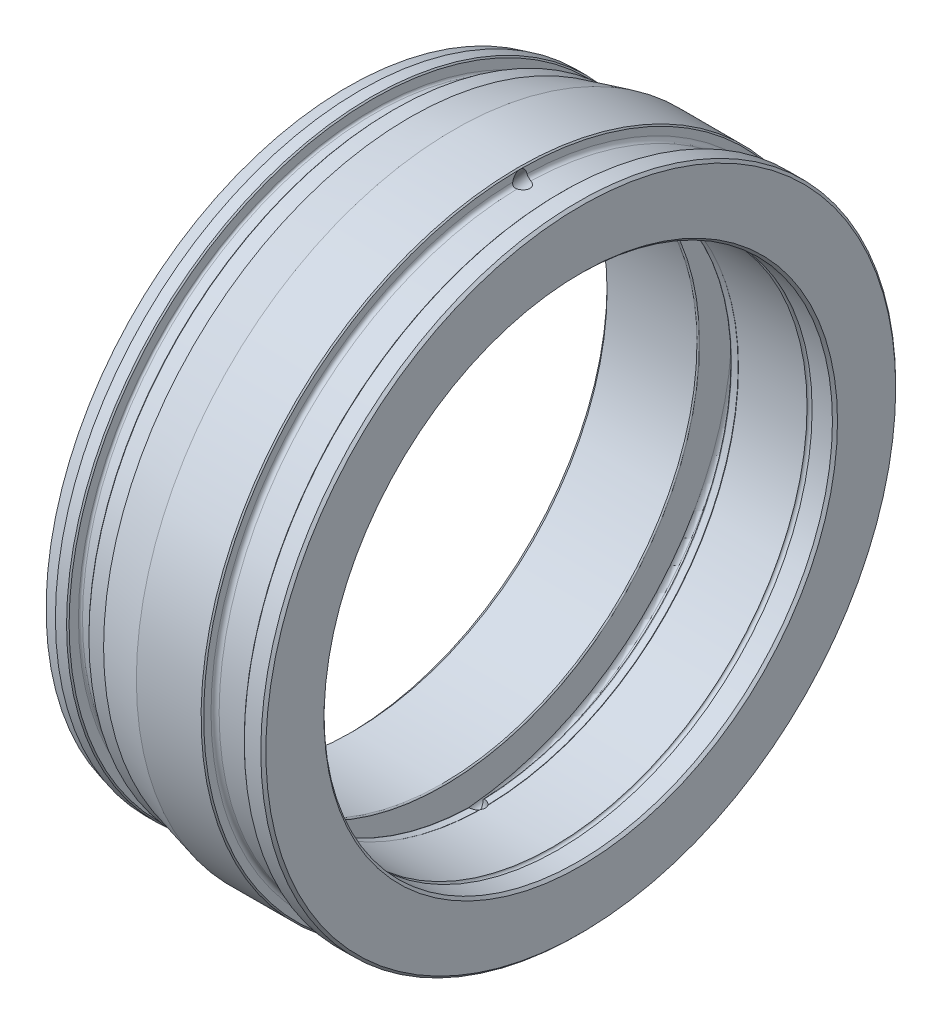
from build123d import *

# Parameters (mm, degrees)
SKETCH2_R          = 1.5
CUT_EXTRUDE1_DEPTH = 142.654606394
CIRPATTERN1_COUNT  = 2
FILLET1_R          = 0.25
CUT_EXTRUDE2_DEPTH = 0.01


with BuildPart() as part:
    # Sketch1 → Revolve1 (revolve)
    with BuildSketch(Plane.XY):
        with BuildLine():
            Line((0, 50.545), (0, 62.0025))
            Line((0, 62.0025), (-0.5, 62.5025))
            Line((-0.5, 62.5025), (-3.75, 62.5025))
            Line((-3.75, 62.5025), (-4, 62.2525))
            Line((-4, 62.2525), (-4, 60.8))
            ThreePointArc((-4, 60.8), (-4.234314575, 60.234314575), (-4.8, 60))
            Line((-4.8, 60), (-11.2, 60))
            ThreePointArc((-11.2, 60), (-11.765685425, 60.234314575), (-12, 60.8))
            Line((-12, 60.8), (-12, 62.2525))
            Line((-12, 62.2525), (-12.25, 62.5025))
            Line((-12.25, 62.5025), (-25, 62.5025))
            Line((-25, 62.5025), (-33.7, 60.25))
            Line((-33.7, 60.25), (-33.7, 59.99))
            Line((-33.7, 59.99), (-36.85, 59.99))
            Line((-36.85, 59.99), (-37.1, 59.74))
            Line((-37.1, 59.74), (-37.1, 57.9))
            ThreePointArc((-37.1, 57.9), (-37.217157288, 57.617157288), (-37.5, 57.5))
            Line((-37.5, 57.5), (-40.6, 57.5))
            ThreePointArc((-40.6, 57.5), (-40.882842712, 57.617157288), (-41, 57.9))
            Line((-41, 57.9), (-41, 59.74))
            Line((-41, 59.74), (-41.25, 59.99))
            Line((-41.25, 59.99), (-43.45, 59.99))
            Line((-43.45, 59.99), (-45.95, 59.320127019))
            Line((-45.95, 59.320127019), (-45.95, 51.125))
            Line((-45.95, 51.125), (-44.95, 50.125))
            Line((-44.95, 50.125), (-27, 50.125))
            Line((-27, 50.125), (-27, 56.75))
            ThreePointArc((-27, 56.75), (-26.765685425, 57.315685425), (-26.2, 57.55))
            Line((-26.2, 57.55), (-21.5, 57.55))
            ThreePointArc((-21.5, 57.55), (-20.934314575, 57.315685425), (-20.7, 56.75))
            Line((-20.7, 56.75), (-20.7, 50.125))
            Line((-20.7, 50.125), (-19.138564065, 50.125))
            Line((-19.138564065, 50.125), (-19, 50.045))
            Line((-19, 50.045), (-5.5, 50.045))
            ThreePointArc((-5.5, 50.045), (-5, 50.445), (-4.5, 50.045))
            Line((-4.5, 50.045), (-0.5, 50.045))
            Line((-0.5, 50.045), (0, 50.545))
        make_face()
    revolve(axis=Axis((0, 0, 0), (-1, 0, 0)))

    # Sketch2 → Cut-Extrude1 (cut, symmetric)
    with BuildSketch(Plane(origin=(-12, 60, 0), x_dir=(0.7503365607322025, -0.6610560079362185, 0), z_dir=(-0.6610560079362185, -0.7503365607322025, 0))):
        Circle(SKETCH2_R)
    cut_extrude1 = extrude(amount=CUT_EXTRUDE1_DEPTH, both=True, mode=Mode.SUBTRACT)

    # CirPattern1: Cut-Extrude1 ×2 about axis
    cirpattern1_axis = Axis((-44.95, 0, 0), (1, 0, 0))
    for i in range(1, CIRPATTERN1_COUNT):
        add(cut_extrude1.rotate(cirpattern1_axis, i * 360 / CIRPATTERN1_COUNT), mode=Mode.SUBTRACT)

    # Fillet1
    fillet1_edges = [part.edges().sort_by_distance(p)[0] for p in [
        (-27, -50.125, 0),
        (-20.7, 0, 50.125),
        (-20.7, 0, -50.125),
    ]]
    fillet(fillet1_edges, radius=FILLET1_R)

    # Sketch3 → Cut-Extrude2 (cut)
    with BuildSketch(Plane.ZY.offset(45.95)):
        Polygon((-7.088400188, 55.487621534), (-6.410415412, 55.56825054), (-5.99955804, 52.119432431), (-6.342406598, 52.078767367), (-6.713300028, 55.189644771), (-7.254566053, 55.125141566), align=None)
        Polygon((-4.184736873, 55.782023718), (-3.500442001, 55.819183174), (-3.311840238, 52.338113462), (-3.657493283, 52.319183174), (-3.827865879, 55.459507693), (-4.374740879, 55.430060577), align=None)
        Polygon((-1.326334379, 55.93482257), (-0.679198963, 55.93482257), (-0.679198963, 52.43482257), (-0.993301527, 52.43482257), (-0.993301527, 55.575848212), (-1.531763065, 55.575848212), align=None)
        Polygon((1.459617342, 55.939659956), (2.143912214, 55.924235276), (2.065386573, 52.443165565), (1.719733528, 52.450877904), (1.790546829, 55.591202424), (1.243671829, 55.603822616), align=None)
        Polygon((4.330415968, 55.800025665), (5.014710839, 55.749544896), (4.758801384, 52.268475185), (4.413148339, 52.294416691), (4.64381741, 55.43474121), (4.09694241, 55.474705153), align=None)
        Polygon((6.189360449, 53.573698337), (7.478723429, 53.413141446), (7.442966218, 53.127083754), (6.153603237, 53.287640645), align=None)
        Polygon((9.67777724, 55.111238801), (10.076715541, 55.035517647), (10.639716342, 53.545633833), (11.718742785, 54.722116205), (12.113474355, 54.647096173), (10.781342945, 53.184556109), (11.5294399, 51.217909474), (11.130501599, 51.293630628), (10.516318906, 52.895693929), (9.351054483, 51.632973577), (8.952116182, 51.708694731), (10.376795669, 53.261679506), align=None)
        Polygon((12.756794683, 54.489275176), (13.152928497, 54.391819247), (13.638805901, 52.871787196), (14.779531061, 53.992179824), (15.170055901, 53.89682726), (13.760099972, 52.502997132), (14.406534266, 50.495685433), (14.010400452, 50.593141362), (13.480352375, 52.228157388), (12.248481382, 51.02573351), (11.852347568, 51.123189439), (13.359759427, 52.601855305), align=None)
    extrude(amount=-CUT_EXTRUDE2_DEPTH, mode=Mode.SUBTRACT)


solid = part.part
